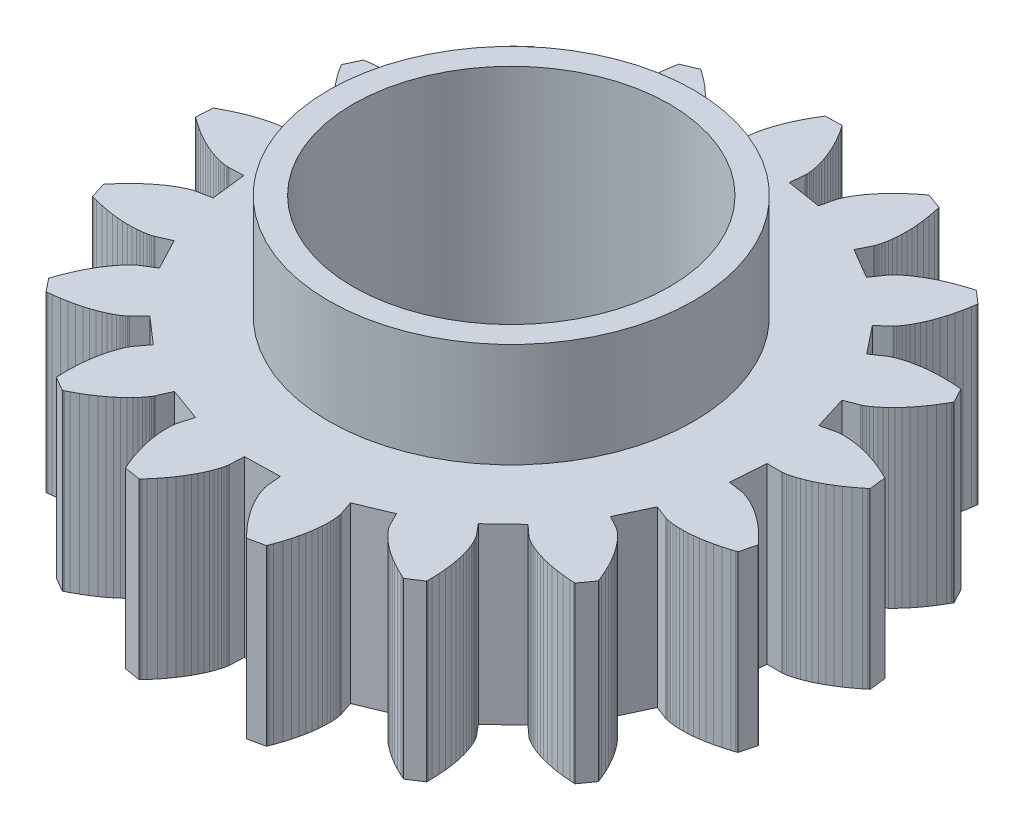
from build123d import *

# Parameters (mm, degrees)
BOSS_EXTRUDE1_DEPTH     = 5
SKETCH3_R               = 5.25
BOSS_EXTRUDE2_DEPTH     = 3
BOSS_EXTRUDE3_START     = -6
SKETCH3_2_R             = 5.25
BOSS_EXTRUDE3_DEPTH     = 1
CUT_EXTRUDE1_DEPTH      = 15.70772094
CUT_EXTRUDE1_DEPTH_BACK = 15.70772094
SKETCH2_R               = 4.55


with BuildPart() as part:
    # Sketch1 → Boss-Extrude1 (new body)
    with BuildSketch(Plane(origin=(0, 0, 0), x_dir=(1, 0, 0), z_dir=(0, 1, 0))):
        Polygon((7.35, 0), (7.766319, 1.4e-05), (7.778421, 0.000519), (7.803546, 0.002554), (7.841567, 0.007188), (7.89229, 0.015481), (7.955458, 0.02848), (8.030748, 0.047216), (8.117774, 0.072701), (8.216087, 0.105924), (8.325179, 0.147849), (8.444479, 0.199407), (8.573361, 0.2615), (8.711141, 0.334991), (8.85708, 0.420705), (9.010389, 0.519425), (9.170226, 0.631889), (9.335704, 0.758787), (9.420269, 0.82785), (9.44158, 0.845714), (9.45226, 0.854736), (9.457605, 0.85927), (9.46028, 0.861542), (9.405526, 1.336443), (9.401764, 1.33846), (9.395519, 1.341643), (9.383051, 1.347968), (9.358203, 1.360453), (9.260024, 1.40822), (9.069801, 1.493667), (8.888386, 1.566364), (8.716486, 1.627187), (8.554748, 1.677047), (8.403761, 1.716887), (8.264055, 1.747681), (8.136096, 1.770425), (8.020287, 1.786142), (7.916969, 1.795868), (7.826415, 1.800659), (7.748834, 1.801581), (7.68437, 1.799707), (7.633099, 1.796114), (7.595031, 1.791881), (7.570112, 1.788085), (7.558218, 1.785793), (7.153051, 1.690077), (6.853671, 2.655126), (7.241872, 2.805531), (7.252974, 2.810373), (7.275668, 2.821347), (7.309447, 2.839403), (7.353749, 2.86546), (7.407956, 2.900399), (7.471393, 2.945068), (7.543336, 3.00027), (7.623009, 3.066764), (7.709589, 3.145266), (7.802208, 3.236439), (7.899957, 3.340896), (8.001884, 3.459197), (8.107005, 3.591842), (8.214299, 3.739278), (8.322716, 3.901887), (8.43118, 4.079993), (8.485085, 4.174941), (8.498504, 4.199296), (8.505203, 4.211567), (8.50855, 4.217726), (8.510223, 4.220811), (8.287613, 4.643864), (8.283376, 4.644386), (8.276403, 4.645098), (8.262492, 4.646492), (8.234812, 4.649157), (8.126008, 4.658233), (7.917763, 4.669193), (7.722337, 4.671446), (7.540073, 4.666064), (7.371245, 4.654131), (7.216063, 4.636738), (7.074667, 4.614985), (6.947132, 4.589969), (6.833466, 4.562789), (6.733611, 4.534536), (6.647441, 4.506292), (6.574766, 4.479126), (6.515332, 4.454091), (6.468822, 4.432219), (6.434854, 4.414521), (6.412988, 4.401979), (6.402725, 4.395546), (6.059495, 4.15993), (5.431716, 4.951663), (5.73937, 5.232145), (5.747973, 5.240672), (5.76517, 5.259102), (5.790145, 5.288141), (5.822043, 5.328442), (5.859968, 5.380604), (5.902985, 5.445173), (5.950129, 5.522635), (6.000401, 5.613421), (6.052777, 5.717898), (6.106206, 5.836372), (6.159619, 5.969087), (6.211929, 6.116219), (6.262034, 6.277881), (6.308823, 6.45412), (6.351178, 6.644913), (6.387977, 6.850174), (6.403944, 6.958183), (6.407658, 6.985741), (6.409472, 6.999604), (6.410369, 7.006555), (6.410814, 7.010037), (6.050412, 7.324105), (6.046273, 7.323062), (6.039513, 7.321207), (6.026038, 7.317481), (5.999265, 7.309968), (5.894529, 7.279125), (5.696387, 7.214119), (5.513344, 7.145624), (5.345332, 7.074764), (5.192216, 7.002649), (5.053795, 6.930372), (4.929806, 6.85901), (4.81992, 6.789613), (4.723748, 6.723207), (4.640842, 6.66079), (4.570694, 6.603325), (4.51274, 6.55174), (4.466363, 6.506926), (4.430894, 6.469729), (4.405613, 6.440956), (4.389755, 6.421362), (4.382509, 6.411655), (4.147571, 6.067961), (3.276177, 6.57945), (3.461734, 6.95213), (3.466676, 6.963188), (3.476054, 6.986586), (3.488853, 7.022687), (3.504038, 7.071789), (3.520559, 7.134128), (3.537347, 7.209876), (3.553324, 7.299139), (3.567406, 7.401954), (3.578503, 7.518296), (3.585527, 7.648071), (3.587391, 7.791119), (3.583018, 7.947212), (3.571341, 8.116057), (3.551305, 8.297297), (3.521877, 8.490507), (3.482043, 8.6952), (3.457914, 8.801683), (3.451423, 8.828723), (3.448107, 8.842304), (3.446431, 8.849111), (3.445589, 8.852518), (2.996069, 9.015186), (2.992586, 9.012717), (2.986953, 9.008546), (2.975734, 9.000204), (2.953483, 8.983526), (2.866961, 8.916932), (2.705682, 8.784738), (2.559743, 8.654746), (2.428674, 8.527978), (2.311948, 8.40542), (2.208984, 8.288021), (2.119147, 8.176687), (2.04175, 8.072281), (1.976061, 7.975619), (1.921301, 7.887467), (1.876649, 7.808542), (1.841243, 7.739505), (1.814187, 7.680964), (1.79455, 7.633467), (1.78137, 7.597503), (1.773661, 7.573504), (1.770411, 7.561835), (1.675494, 7.156481), (0.678172, 7.318646), (0.716572, 7.733191), (0.717186, 7.745288), (0.717477, 7.770493), (0.716371, 7.808779), (0.712794, 7.860051), (0.705679, 7.924149), (0.69397, 8.000847), (0.676623, 8.089853), (0.652613, 8.190812), (0.620933, 8.303307), (0.580602, 8.426856), (0.530666, 8.560917), (0.470201, 8.70489), (0.398318, 8.858115), (0.314164, 9.019878), (0.216928, 9.189411), (0.10584, 9.365892), (0.044874, 9.456468), (0.029053, 9.479336), (0.021055, 9.490803), (0.017034, 9.496544), (0.015018, 9.499417), (-0.46291, 9.488715), (-0.465265, 9.485155), (-0.469011, 9.479231), (-0.476459, 9.467399), (-0.491183, 9.44381), (-0.547806, 9.350457), (-0.65044, 9.168929), (-0.739565, 8.994996), (-0.81599, 8.829441), (-0.88056, 8.672993), (-0.934162, 8.526327), (-0.977715, 8.390058), (-1.012169, 8.264743), (-1.038503, 8.150879), (-1.057722, 8.048898), (-1.070848, 7.959172), (-1.078924, 7.882008), (-1.083005, 7.817646), (-1.084158, 7.766262), (-1.083456, 7.727966), (-1.081975, 7.702802), (-1.080791, 7.690748), (-1.022867, 7.278478), (-2.011423, 7.069418), (-2.125367, 7.469841), (-2.129165, 7.481343), (-2.137998, 7.504952), (-2.15286, 7.540253), (-2.174718, 7.58677), (-2.204507, 7.64397), (-2.243132, 7.711258), (-2.29146, 7.787987), (-2.35032, 7.873456), (-2.420498, 7.96691), (-2.502736, 8.067546), (-2.597729, 8.174516), (-2.70612, 8.286924), (-2.8285, 8.403835), (-2.965407, 8.524275), (-3.117319, 8.647234), (-3.284657, 8.771668), (-3.374226, 8.834104), (-3.39724, 8.849713), (-3.40884, 8.857516), (-3.414664, 8.861417), (-3.417582, 8.863367), (-3.85937, 8.680741), (-3.86028, 8.676571), (-3.861633, 8.669693), (-3.864304, 8.65597), (-3.869512, 8.628654), (-3.888588, 8.521151), (-3.918716, 8.314806), (-3.938992, 8.120422), (-3.95045, 7.938439), (-3.954144, 7.76923), (-3.951145, 7.613105), (-3.94253, 7.470305), (-3.929389, 7.341006), (-3.912813, 7.225317), (-3.893893, 7.123281), (-3.87372, 7.034872), (-3.853376, 6.960001), (-3.833931, 6.898511), (-3.816445, 6.85018), (-3.801956, 6.814724), (-3.791485, 6.791795), (-3.786026, 6.780982), (-3.583085, 6.417476), (-4.429365, 5.865427), (-4.680264, 6.197648), (-4.68796, 6.207002), (-4.704725, 6.225825), (-4.731336, 6.253374), (-4.768521, 6.288854), (-4.816962, 6.33143), (-4.877286, 6.380221), (-4.950068, 6.434311), (-5.035828, 6.492746), (-5.135027, 6.554538), (-5.248066, 6.61867), (-5.375286, 6.684101), (-5.516964, 6.749763), (-5.673313, 6.814571), (-5.844483, 6.877422), (-6.030554, 6.9372), (-6.231544, 6.992782), (-6.337619, 7.018646), (-6.364717, 7.024887), (-6.378353, 7.027973), (-6.385193, 7.029506), (-6.388618, 7.030271), (-6.734601, 6.700385), (-6.733943, 6.696167), (-6.73272, 6.689265), (-6.730253, 6.675504), (-6.725242, 6.648151), (-6.704195, 6.541016), (-6.657748, 6.337722), (-6.606435, 6.14914), (-6.551379, 5.975307), (-6.4937, 5.816189), (-6.434503, 5.671691), (-6.374885, 5.541645), (-6.315923, 5.425825), (-6.258675, 5.323937), (-6.204173, 5.235625), (-6.153426, 5.160474), (-6.107408, 5.098008), (-6.067064, 5.047694), (-6.033299, 5.008944), (-6.006981, 4.981116), (-5.988934, 4.963518), (-5.979937, 4.955407), (-5.659387, 4.689759), (-6.249096, 3.869276), (-6.603065, 4.088428), (-6.61362, 4.09437), (-6.636053, 4.105866), (-6.670819, 4.121942), (-6.71831, 4.141593), (-6.778859, 4.163795), (-6.852735, 4.1875), (-6.940142, 4.211646), (-7.04122, 4.235154), (-7.156042, 4.256939), (-7.284615, 4.275906), (-7.42688, 4.290962), (-7.582711, 4.30101), (-7.751914, 4.304961), (-7.934229, 4.301734), (-8.12933, 4.290259), (-8.336826, 4.269481), (-8.445081, 4.25528), (-8.472604, 4.251311), (-8.486434, 4.249262), (-8.493365, 4.248222), (-8.496835, 4.247698), (-8.700286, 3.815104), (-8.69815, 3.811409), (-8.694516, 3.805415), (-8.687244, 3.793474), (-8.672691, 3.769779), (-8.614364, 3.677481), (-8.497615, 3.504694), (-8.381643, 3.347383), (-8.267509, 3.205176), (-8.156244, 3.07764), (-8.048846, 2.964283), (-7.946277, 2.864556), (-7.849457, 2.777857), (-7.759268, 2.703529), (-7.676545, 2.640869), (-7.602077, 2.589125), (-7.536602, 2.5475), (-7.480806, 2.515158), (-7.435323, 2.491222), (-7.40073, 2.474781), (-7.377544, 2.46489), (-7.366225, 2.460577), (-6.971358, 2.328664), (-7.224852, 1.350559), (-7.634085, 1.427044), (-7.646074, 1.428771), (-7.671145, 1.431387), (-7.70937, 1.433818), (-7.760753, 1.434987), (-7.825234, 1.433817), (-7.902685, 1.429234), (-7.992912, 1.420174), (-8.095656, 1.405581), (-8.210594, 1.384416), (-8.337337, 1.355657), (-8.475434, 1.318304), (-8.624371, 1.271381), (-8.783576, 1.213942), (-8.952414, 1.145073), (-9.130195, 1.063894), (-9.316173, 0.969564), (-9.411988, 0.917216), (-9.436219, 0.903572), (-9.448374, 0.896666), (-9.454462, 0.893192), (-9.457509, 0.891449), (-9.49095, 0.414573), (-9.487623, 0.411899), (-9.482069, 0.407623), (-9.470975, 0.399115), (-9.448845, 0.382277), (-9.361115, 0.317282), (-9.189831, 0.198337), (-9.024863, 0.093543), (-8.867066, 0.002169), (-8.717243, -0.076561), (-8.576148, -0.143467), (-8.444479, -0.199407), (-8.322878, -0.245277), (-8.211929, -0.282005), (-8.112157, -0.310551), (-8.024025, -0.3319), (-7.947935, -0.347061), (-7.884224, -0.357064), (-7.833166, -0.362953), (-7.794969, -0.365788), (-7.769776, -0.366635), (-7.757663, -0.366568), (-7.341808, -0.346931), (-7.224852, -1.350559), (-7.63408, -1.427071), (-7.645883, -1.429791), (-7.670207, -1.436408), (-7.706728, -1.44795), (-7.755064, -1.465422), (-7.814768, -1.489806), (-7.885333, -1.522058), (-7.966194, -1.5631), (-8.056729, -1.613823), (-8.15626, -1.675079), (-8.264055, -1.747681), (-8.379333, -1.832398), (-8.501263, -1.929955), (-8.628967, -2.041026), (-8.761526, -2.166236), (-8.897976, -2.306155), (-9.03732, -2.461298), (-9.107754, -2.544724), (-9.12542, -2.566199), (-9.13426, -2.57703), (-9.138681, -2.582469), (-9.140893, -2.585195), (-8.999808, -3.041949), (-8.99574, -3.04324), (-8.989016, -3.045222), (-8.975598, -3.049148), (-8.94888, -3.056854), (-8.843595, -3.085768), (-8.64091, -3.134806), (-8.449226, -3.17293), (-8.269076, -3.201131), (-8.10093, -3.220423), (-7.945194, -3.231841), (-7.802208, -3.236439), (-7.672249, -3.235284), (-7.555524, -3.229453), (-7.452177, -3.220029), (-7.362285, -3.2081), (-7.285856, -3.19475), (-7.222834, -3.181062), (-7.173096, -3.16811), (-7.136454, -3.156954), (-7.112656, -3.148644), (-7.101386, -3.144206), (-6.720706, -2.97567), (-6.249096, -3.869276), (-6.60305, -4.088452), (-6.613074, -4.095252), (-6.633364, -4.110209), (-6.66325, -4.134164), (-6.702011, -4.167918), (-6.748874, -4.212223), (-6.803024, -4.267787), (-6.863598, -4.335269), (-6.929696, -4.415271), (-7.000378, -4.508345), (-7.074667, -4.614985), (-7.151557, -4.735625), (-7.230011, -4.87064), (-7.308969, -5.020342), (-7.387345, -5.184983), (-7.464036, -5.364745), (-7.537926, -5.559749), (-7.573467, -5.662985), (-7.582182, -5.689391), (-7.586513, -5.702684), (-7.588671, -5.709353), (-7.589748, -5.712693), (-7.293193, -6.087638), (-7.288932, -6.087373), (-7.281947, -6.086792), (-7.268017, -6.085605), (-7.240319, -6.083139), (-7.131699, -6.072068), (-6.924986, -6.044576), (-6.732474, -6.010882), (-6.554302, -5.972101), (-6.390542, -5.929348), (-6.241197, -5.883737), (-6.106206, -5.836372), (-5.985439, -5.788349), (-5.878703, -5.740745), (-5.78574, -5.694625), (-5.706227, -5.651028), (-5.639781, -5.610971), (-5.585959, -5.575441), (-5.544259, -5.545395), (-5.514122, -5.521757), (-5.494933, -5.50541), (-5.486027, -5.497201), (-5.191936, -5.202529), (-4.429365, -5.865427), (-4.680242, -6.197665), (-4.687132, -6.207627), (-4.700649, -6.228903), (-4.719864, -6.262037), (-4.743813, -6.307513), (-4.771507, -6.365755), (-4.801928, -6.437129), (-4.834035, -6.521935), (-4.866769, -6.620413), (-4.899055, -6.732735), (-4.929806, -6.85901), (-4.957923, -6.999279), (-4.982307, -7.153517), (-5.001853, -7.321634), (-5.015462, -7.503469), (-5.022037, -7.698797), (-5.020494, -7.907324), (-5.016342, -8.016428), (-5.014929, -8.0442), (-5.014165, -8.058159), (-5.013769, -8.065158), (-5.013567, -8.068661), (-4.601591, -8.311159), (-4.597714, -8.309372), (-4.591411, -8.306307), (-4.57885, -8.300169), (-4.553913, -8.287863), (-4.456627, -8.238301), (-4.273804, -8.137993), (-4.106464, -8.037031), (-3.954333, -7.936505), (-3.817075, -7.837483), (-3.694292, -7.741002), (-3.585527, -7.648071), (-3.490263, -7.559664), (-3.407931, -7.476718), (-3.337906, -7.40013), (-3.279511, -7.330753), (-3.232023, -7.269398), (-3.194671, -7.216825), (-3.16664, -7.173745), (-3.147077, -7.140816), (-3.135089, -7.118641), (-3.12975, -7.107769), (-2.961966, -6.726757), (-2.011423, -7.069418), (-2.125341, -7.469849), (-2.128167, -7.481627), (-2.133085, -7.50635), (-2.139033, -7.544187), (-2.144938, -7.595244), (-2.149722, -7.659557), (-2.152305, -7.7371), (-2.151609, -7.827778), (-2.146558, -7.931431), (-2.136089, -8.047831), (-2.119147, -8.176687), (-2.094695, -8.317641), (-2.061714, -8.470273), (-2.01921, -8.634098), (-1.966213, -8.80857), (-1.901784, -8.993083), (-1.825016, -9.186972), (-1.781732, -9.287208), (-1.770382, -9.312594), (-1.764627, -9.325335), (-1.761729, -9.331718), (-1.760275, -9.334912), (-1.288519, -9.412211), (-1.285549, -9.409145), (-1.280779, -9.404009), (-1.271283, -9.393748), (-1.252476, -9.373266), (-1.179663, -9.291907), (-1.045422, -9.132329), (-0.925853, -8.977734), (-0.820309, -8.82904), (-0.728091, -8.687121), (-0.648452, -8.552802), (-0.580602, -8.426856), (-0.523708, -8.310006), (-0.476899, -8.202919), (-0.439269, -8.106206), (-0.40988, -8.02042), (-0.387762, -7.946053), (-0.371924, -7.883537), (-0.361348, -7.83324), (-0.355002, -7.795467), (-0.351834, -7.77046), (-0.350783, -7.758393), (-0.331966, -7.342499), (0.678172, -7.318646), (0.716599, -7.733188), (0.718218, -7.745192), (0.722563, -7.770022), (0.730686, -7.807453), (0.743624, -7.857195), (0.762395, -7.918894), (0.787998, -7.992134), (0.821404, -8.076437), (0.863557, -8.171265), (0.915368, -8.276023), (0.977715, -8.390058), (1.051434, -8.512661), (1.137324, -8.643072), (1.236139, -8.78048), (1.348583, -8.924025), (1.475316, -9.072804), (1.61694, -9.225868), (1.693511, -9.303699), (1.713265, -9.323271), (1.723234, -9.333073), (1.728242, -9.337978), (1.730751, -9.340431), (2.198575, -9.242092), (2.200236, -9.23816), (2.202829, -9.231648), (2.207977, -9.21865), (2.218115, -9.192756), (2.25662, -9.090588), (2.324151, -8.893293), (2.379799, -8.705944), (2.424502, -8.529165), (2.459225, -8.363516), (2.484965, -8.209498), (2.502736, -8.067546), (2.513577, -7.938035), (2.518541, -7.82127), (2.518693, -7.717494), (2.515109, -7.626885), (2.508868, -7.54955), (2.501053, -7.485534), (2.492745, -7.434813), (2.485018, -7.397298), (2.478939, -7.372835), (2.47556, -7.361203), (2.342868, -6.966597), (3.276177, -6.57945), (3.461759, -6.952118), (3.467605, -6.962726), (3.480626, -6.98431), (3.501722, -7.016279), (3.531754, -7.057988), (3.571547, -7.108739), (3.621878, -7.167785), (3.683482, -7.234327), (3.757045, -7.307525), (3.8432, -7.386493), (3.94253, -7.470305), (4.055561, -7.557998), (4.182761, -7.648575), (4.32454, -7.741009), (4.481246, -7.834241), (4.653166, -7.927192), (4.84052, -8.018759), (4.940036, -8.063674), (4.965526, -8.074789), (4.978363, -8.080327), (4.984804, -8.083092), (4.98803, -8.084473), (5.388739, -7.823778), (5.388867, -7.819511), (5.388933, -7.812502), (5.389037, -7.798522), (5.389138, -7.770714), (5.388135, -7.661536), (5.379834, -7.453168), (5.364046, -7.258369), (5.34187, -7.077378), (5.31441, -6.910372), (5.282773, -6.757456), (5.248066, -6.61867), (5.21139, -6.493988), (5.173838, -6.383315), (5.136492, -6.286492), (5.100417, -6.203296), (5.066662, -6.133438), (5.03625, -6.076568), (5.01018, -6.032273), (4.989423, -6.000083), (4.974917, -5.979468), (4.967564, -5.969842), (4.701284, -5.649817), (5.431716, -4.951663), (5.739388, -5.232125), (5.748672, -5.239905), (5.768611, -5.255328), (5.79983, -5.277517), (5.842902, -5.305561), (5.898341, -5.338511), (5.966603, -5.375387), (6.048085, -5.415182), (6.143122, -5.456863), (6.251986, -5.499375), (6.374885, -5.541645), (6.511962, -5.582586), (6.663293, -5.621096), (6.828888, -5.656072), (7.008692, -5.6864), (7.20258, -5.71097), (7.41036, -5.728673), (7.519382, -5.734606), (7.547165, -5.735761), (7.561136, -5.736289), (7.568141, -5.73654), (7.571648, -5.736662), (7.851124, -5.348818), (7.849702, -5.344793), (7.847232, -5.338234), (7.842279, -5.32516), (7.832327, -5.299194), (7.791952, -5.197751), (7.708941, -5.006452), (7.623849, -4.83051), (7.537789, -4.669753), (7.451854, -4.523944), (7.367114, -4.392782), (7.284615, -4.275906), (7.205375, -4.172892), (7.13038, -4.083258), (7.060579, -4.006465), (6.996887, -3.941918), (6.940175, -3.888971), (6.891272, -3.846927), (6.850962, -3.815041), (6.819978, -3.792523), (6.799005, -3.778541), (6.788671, -3.772221), (6.424766, -3.569997), (6.853671, -2.655126), (7.241882, -2.805505), (7.253349, -2.809406), (7.277513, -2.816585), (7.31464, -2.825998), (7.364934, -2.836588), (7.428532, -2.847286), (7.505506, -2.857013), (7.595861, -2.864687), (7.699537, -2.869222), (7.816407, -2.869537), (7.946277, -2.864556), (8.088886, -2.853214), (8.24391, -2.834457), (8.410957, -2.807251), (8.589575, -2.770578), (8.779246, -2.723449), (8.97939, -2.664898), (9.083193, -2.631047), (9.109518, -2.622088), (9.122736, -2.617533), (9.129358, -2.615236), (9.132673, -2.614083), (9.253171, -2.151472), (9.250392, -2.148232), (9.245718, -2.143008), (9.236377, -2.132606), (9.217717, -2.111989), (9.143423, -2.03198), (8.996912, -1.883587), (8.854009, -1.750264), (8.715689, -1.631451), (8.582884, -1.526532), (8.456485, -1.434839), (8.337337, -1.355657), (8.226235, -1.288224), (8.123924, -1.231735), (8.031096, -1.185342), (7.948387, -1.148162), (7.876379, -1.119277), (7.81559, -1.097738), (7.766484, -1.082567), (7.729458, -1.072762), (7.70485, -1.0673), (7.692931, -1.065141), (7.280548, -1.00803), align=None)
    extrude(amount=BOSS_EXTRUDE1_DEPTH)

    # Sketch3 → Boss-Extrude2 (add)
    with BuildSketch(Plane(origin=(0, 5, 0), x_dir=(1, 0, 0), z_dir=(0, 1, 0))):
        with Locations(Location((0, 0, 0), (0, 0, 90))):
            Circle(SKETCH3_R)
    extrude(amount=BOSS_EXTRUDE2_DEPTH)

    # Sketch3<2> → Boss-Extrude3 (add)
    with BuildSketch(Plane(origin=(0, 5, 0), x_dir=(1, 0, 0), z_dir=(0, 1, 0)).offset(BOSS_EXTRUDE3_START)):
        with Locations(Location((0, 0, 0), (0, 0, 90))):
            Circle(SKETCH3_2_R)
    extrude(amount=BOSS_EXTRUDE3_DEPTH)

    # Sketch2 → Cut-Extrude1 (cut, two sides: drawn at the far end of the back side and taken through both)
    with BuildSketch(Plane(origin=(0, 5, 0), x_dir=(1, 0, 0), z_dir=(0, 1, 0)).offset(-CUT_EXTRUDE1_DEPTH_BACK)):
        with Locations(Location((0, 0, 0), (0, 0, 270))):
            Circle(SKETCH2_R)
    extrude(amount=CUT_EXTRUDE1_DEPTH + CUT_EXTRUDE1_DEPTH_BACK, mode=Mode.SUBTRACT)


solid = part.part
